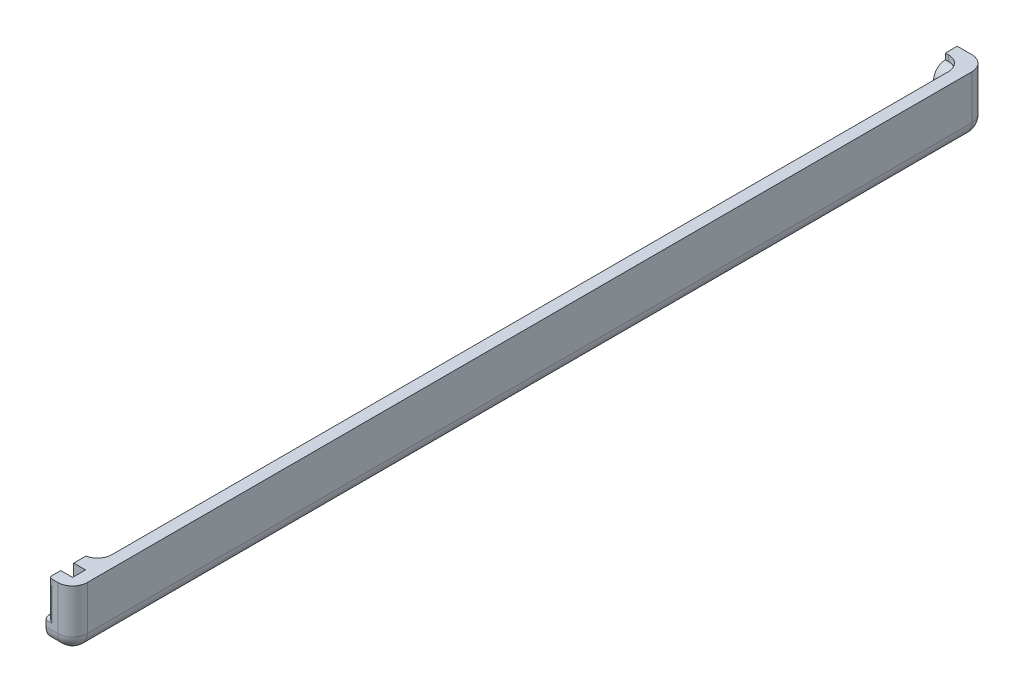
from build123d import *

# Parameters (mm, degrees)
SKETCH1_W                       = 39
SKETCH1_H                       = 155
BOSS_EXTRUDE1_DEPTH             = 2
BOSS_EXTRUDE2_DEPTH             = 38
SKETCH3_W                       = 2
SKETCH3_H                       = 2
BOSS_EXTRUDE3_DEPTH             = 38
SKETCH4_W                       = 2
SKETCH4_H                       = 2
BOSS_EXTRUDE4_DEPTH             = 151
SKETCH6_W                       = 35
SKETCH6_H                       = 2.2
CUT_EXTRUDE1_DEPTH              = 160.340045186
SKETCH7_W                       = 35
SKETCH7_H                       = 2.2
CUT_EXTRUDE2_DEPTH              = 89.490112442
SKETCH5_W                       = 31
SKETCH5_H                       = 2
BOSS_EXTRUDE5_DEPTH             = 2
BOSS_EXTRUDE6_REACH             = 91.367
SKETCH8_W                       = 2
SKETCH8_H                       = 2
BOSS_EXTRUDE6_DIRECTION_2_REACH = 91.367
SKETCH10_W                      = 2
SKETCH10_H                      = 2.2
SKETCH10_W_2                    = 2.2
SKETCH10_H_2                    = 2
BOSS_EXTRUDE8_DEPTH             = 2
SKETCH11_W                      = 2
SKETCH11_H                      = 2.2
SKETCH11_W_2                    = 2.2
SKETCH11_H_2                    = 2
BOSS_EXTRUDE9_DEPTH             = 2
FILLET2_R                       = 2.5
SKETCH14_W                      = 36.5
SKETCH14_H                      = 7.75
BOSS_EXTRUDE10_DEPTH            = 2
SKETCH13_W                      = 31
SKETCH13_H                      = 3
CUT_EXTRUDE4_DEPTH              = 2
FILLET3_R                       = 2
FILLET4_R                       = 0.5
SKETCH15_R                      = 5.1
CUT_EXTRUDE5_DEPTH              = 90.367219941
SKETCH16_R                      = 7.1
BOSS_EXTRUDE11_DEPTH            = 1
FILLET5_R                       = 0.5
CUT_EXTRUDE3_DEPTH              = 160.340045186
FILLET6_R                       = 0.4
FILLET7_R                       = 0.5
CUT_EXTRUDE6_DEPTH              = 6
SKETCH18_W                      = 29
SKETCH18_H                      = 3
CUT_EXTRUDE8_DEPTH              = 90.367220028
CUT_EXTRUDE11_DEPTH             = 90.367220028
CUT_EXTRUDE11_DEPTH_BACK        = 90.367220028
SKETCH20_W                      = 29
SKETCH20_H                      = 34
SKETCH21_W                      = 155
SKETCH21_H                      = 20
SKETCH21_H_2                    = 10
CUT_EXTRUDE12_DEPTH             = 90.367219941


with BuildPart() as part:
    # Sketch1 → Boss-Extrude1 (new body)
    with BuildSketch(Plane(origin=(0, 0, 0), x_dir=(1, 0, 0), z_dir=(0, 1, 0))):
        Rectangle(SKETCH1_W, SKETCH1_H)
    extrude(amount=BOSS_EXTRUDE1_DEPTH)

    # Sketch2 → Boss-Extrude2 (add)
    with BuildSketch(Plane(origin=(0, 2, 0), x_dir=(1, 0, 0), z_dir=(0, 1, 0))):
        Polygon((-17.5, -77.5), (-17.5, -75.5), (-17.5, 75.5), (17.5, 75.5), (17.5, -75.5), (17.5, -77.5), (19.5, -77.5), (19.5, 77.5), (-19.5, 77.5), (-19.5, -77.5), align=None)
    extrude(amount=BOSS_EXTRUDE2_DEPTH)

    # Sketch3 → Boss-Extrude3 (add)
    with BuildSketch(Plane(origin=(0, 2, 0), x_dir=(1, 0, 0), z_dir=(0, 1, 0))):
        with Locations((-16.5, -76.5)):
            Rectangle(SKETCH3_W, SKETCH3_H)
        with Locations((-16.5, -72.3)):
            Rectangle(SKETCH3_W, SKETCH3_H)
        with Locations((16.5, -76.5)):
            Rectangle(SKETCH3_W, SKETCH3_H)
        with Locations((16.5, -72.3)):
            Rectangle(SKETCH3_W, SKETCH3_H)
    extrude(amount=BOSS_EXTRUDE3_DEPTH)

    # Sketch4 → Boss-Extrude4 (add)
    with BuildSketch(Plane.XY.offset(-75.5)):
        with Locations((-16.5, 39)):
            Rectangle(SKETCH4_W, SKETCH4_H)
        Polygon((-15.5, 33.8), (-17.5, 31.8), (-17.5, 35.8), (-15.5, 35.8), align=None)
        Polygon((15.5, 35.8), (17.5, 35.8), (17.5, 31.8), (15.5, 33.8), align=None)
        with Locations((16.5, 39)):
            Rectangle(SKETCH4_W, SKETCH4_H)
    extrude(amount=BOSS_EXTRUDE4_DEPTH)

    # Sketch6 → Cut-Extrude1 (cut, through all)
    with BuildSketch(Plane.XY.offset(-75.5)):
        with Locations((0, 36.9)):
            Rectangle(SKETCH6_W, SKETCH6_H)
    extrude(amount=CUT_EXTRUDE1_DEPTH, mode=Mode.SUBTRACT)

    # Sketch7 → Cut-Extrude2 (cut, through all)
    with BuildSketch(Plane(origin=(0, 2, 0), x_dir=(1, 0, 0), z_dir=(0, 1, 0))):
        with Locations((0, -74.4)):
            Rectangle(SKETCH7_W, SKETCH7_H)
    extrude(amount=CUT_EXTRUDE2_DEPTH, mode=Mode.SUBTRACT)

    # Sketch5 → Boss-Extrude5 (add)
    with BuildSketch(Plane(origin=(0, 2, 0), x_dir=(1, 0, 0), z_dir=(0, 1, 0))):
        with Locations((0, -76.5)):
            Rectangle(SKETCH5_W, SKETCH5_H)
        with Locations((0, -72.3)):
            Rectangle(SKETCH5_W, SKETCH5_H)
    extrude(amount=BOSS_EXTRUDE5_DEPTH)

    # Boss-Extrude6: up to this face of the body (flat: up to its plane)
    boss_extrude6_end = Plane(part.part.faces().sort_by_distance((17.5, 16.9, -2.1))[0])
    # Sketch8 → Boss-Extrude6 (add, up to the picked face)
    with BuildSketch(Plane(origin=(0, 0, 0), x_dir=(0, 0, -1), z_dir=(1, 0, 0)), mode=Mode.PRIVATE) as boss_extrude6_sk1:
        with Locations((74.5, 39)):
            Rectangle(SKETCH8_W, SKETCH8_H)
    boss_extrude6_tool1 = split(extrude(boss_extrude6_sk1.sketch, amount=BOSS_EXTRUDE6_REACH, mode=Mode.PRIVATE), bisect_by=boss_extrude6_end, keep=Keep.BOTH, mode=Mode.PRIVATE)
    # Sketch8 → Boss-Extrude6 (add, up to the picked face)
    with BuildSketch(Plane(origin=(0, 0, 0), x_dir=(0, 0, -1), z_dir=(1, 0, 0)), mode=Mode.PRIVATE) as boss_extrude6_sk2:
        Polygon((75.5, 35.8), (73.5, 35.8), (73.5, 33.8), (75.5, 31.8), align=None)
    boss_extrude6_tool2 = split(extrude(boss_extrude6_sk2.sketch, amount=BOSS_EXTRUDE6_REACH, mode=Mode.PRIVATE), bisect_by=boss_extrude6_end, keep=Keep.BOTH, mode=Mode.PRIVATE)
    add(boss_extrude6_tool1.solids().sort_by(Axis((0, 39, -74.5), (1, 0, 0)))[0])
    add(boss_extrude6_tool2.solids().sort_by(Axis((0, 34.244444, -74.611111), (1, 0, 0)))[0])

    # Boss-Extrude6 direction 2: up to this face of the body (flat: up to its plane)
    boss_extrude6_direction_2_end = Plane(part.part.faces().sort_by_distance((-17.5, 16.9, -2.1))[0])
    # Sketch8 → Boss-Extrude6 direction 2 (add, up to the picked face)
    with BuildSketch(Plane(origin=(0, 0, 0), x_dir=(0, 0, -1), z_dir=(1, 0, 0)), mode=Mode.PRIVATE) as boss_extrude6_direction_2_sk1:
        with Locations((74.5, 39)):
            Rectangle(SKETCH8_W, SKETCH8_H)
    boss_extrude6_direction_2_tool1 = split(extrude(boss_extrude6_direction_2_sk1.sketch, amount=-BOSS_EXTRUDE6_DIRECTION_2_REACH, mode=Mode.PRIVATE), bisect_by=boss_extrude6_direction_2_end, keep=Keep.BOTH, mode=Mode.PRIVATE)
    # Sketch8 → Boss-Extrude6 direction 2 (add, up to the picked face)
    with BuildSketch(Plane(origin=(0, 0, 0), x_dir=(0, 0, -1), z_dir=(1, 0, 0)), mode=Mode.PRIVATE) as boss_extrude6_direction_2_sk2:
        Polygon((75.5, 35.8), (73.5, 35.8), (73.5, 33.8), (75.5, 31.8), align=None)
    boss_extrude6_direction_2_tool2 = split(extrude(boss_extrude6_direction_2_sk2.sketch, amount=-BOSS_EXTRUDE6_DIRECTION_2_REACH, mode=Mode.PRIVATE), bisect_by=boss_extrude6_direction_2_end, keep=Keep.BOTH, mode=Mode.PRIVATE)
    add(boss_extrude6_direction_2_tool1.solids().sort_by(Axis((0, 39, -74.5), (-1, 0, 0)))[0])
    add(boss_extrude6_direction_2_tool2.solids().sort_by(Axis((0, 34.244444, -74.611111), (-1, 0, 0)))[0])

    # Sketch10 → Boss-Extrude8 (add)
    with BuildSketch(Plane(origin=(-17.5, 0, 0), x_dir=(0, 0, -1), z_dir=(1, 0, 0))):
        with Locations((-76.5, 36.9)):
            Rectangle(SKETCH10_W, SKETCH10_H)
        with Locations((-74.4, 39)):
            Rectangle(SKETCH10_W_2, SKETCH10_H_2)
    extrude(amount=BOSS_EXTRUDE8_DEPTH)

    # Sketch11 → Boss-Extrude9 (add)
    with BuildSketch(Plane.ZY.offset(-17.5)):
        with Locations((76.5, 36.9)):
            Rectangle(SKETCH11_W, SKETCH11_H)
        with Locations((74.4, 39)):
            Rectangle(SKETCH11_W_2, SKETCH11_H_2)
    extrude(amount=BOSS_EXTRUDE9_DEPTH)

    # Fillet2
    fillet2_edges = [part.edges().sort_by_distance(p)[0] for p in [
        (-17.5, 16.9, 71.3),
        (17.5, 16.9, 71.3),
        (19.5, 20, 77.5),
        (-19.5, 20, 77.5),
        (-19.5, 20, -77.5),
        (-17.5, 16.9, -75.5),
        (17.5, 16.9, -75.5),
        (19.5, 20, -77.5),
        (19.5, 40, 0),
        (-19.5, 40, 0),
        (19.5, 0, 0),
        (-19.5, 0, 0),
        (0, 40, -77.5),
        (0, 0, 77.5),
        (0, 0, -77.5),
        (-17.5, 40, 77.5),
        (17.5, 40, 77.5),
    ]]
    fillet(fillet2_edges, radius=FILLET2_R)

    # Sketch14 → Boss-Extrude10 (add)
    with BuildSketch(Plane.XY.offset(-75.5)):
        with Locations((0, 5.125)):
            Rectangle(SKETCH14_W, SKETCH14_H)
    extrude(amount=BOSS_EXTRUDE10_DEPTH)

    # Sketch13 → Cut-Extrude4 (cut)
    with BuildSketch(Plane(origin=(0, 0, -77.5), x_dir=(-1, 0, 0), z_dir=(0, 0, -1))):
        with Locations((0, 5.5)):
            Rectangle(SKETCH13_W, SKETCH13_H)
    extrude(amount=-CUT_EXTRUDE4_DEPTH, mode=Mode.SUBTRACT)

    # Fillet3
    fillet3_edges = [part.edges().sort_by_distance(p)[0] for p in [
        (0, 9, -73.5),
    ]]
    fillet(fillet3_edges, radius=FILLET3_R - 0.0001)  # a hair under: the kernel refuses the full size

    # Fillet4
    fillet4_edges = [part.edges().sort_by_distance(p)[0] for p in [
        (15.5, 5.5, -75.5),
        (15.5, 4, -76.5),
        (0, 7, -75.5),
        (15.5, 7, -76.5),
        (-15.5, 5.5, -75.5),
        (-15.5, 7, -76.5),
        (0, 4, -75.5),
        (-15.5, 4, -76.5),
        (15.5, 5.5, -77.5),
        (0, 4, -77.5),
        (-15.5, 5.5, -77.5),
        (0, 7, -77.5),
    ]]
    fillet(fillet4_edges, radius=FILLET4_R)

    # Sketch15 → Cut-Extrude5 (cut, through all)
    with BuildSketch(Plane.XZ):
        with Locations(Location((0, 38.75, 0), (0, 0, 270))):
            Circle(SKETCH15_R)
        with Locations(Location((0, -38.75, 0), (0, 0, 270))):
            Circle(SKETCH15_R)
    extrude(amount=-CUT_EXTRUDE5_DEPTH, mode=Mode.SUBTRACT)

    # Sketch16 → Boss-Extrude11 (add)
    with BuildSketch(Plane(origin=(0, 2, 0), x_dir=(1, 0, 0), z_dir=(0, 1, 0))):
        with Locations(Location((0, 38.75, 0), (0, 0, 270))):
            Circle(SKETCH16_R)
        with Locations(Location((0, -38.75, 0), (0, 0, 270))):
            Circle(SKETCH16_R)
    extrude(amount=BOSS_EXTRUDE11_DEPTH)

    # Fillet5
    fillet5_edges = [part.edges().sort_by_distance(p)[0] for p in [
        (0, 2, -45.85),
        (0, 3, -45.85),
        (0, 2, 31.65),
        (0, 3, 31.65),
    ]]
    fillet(fillet5_edges, radius=FILLET5_R - 0.0001)  # a hair under: the kernel refuses the full size

    # Sketch12 → Cut-Extrude3 (cut, through all)
    with BuildSketch(Plane.XY.offset(-75.5)):
        with BuildLine():
            Line((1.668907005, 12.688040659), (2.22520934, 10.250720878))
            ThreePointArc((2.22520934, 10.250720878), (4.338837391, 10.990311321), (6.234898019, 12.181685175))
            Line((6.234898019, 12.181685175), (4.676173514, 14.136263881))
            ThreePointArc((4.676173514, 14.136263881), (3.254128043, 13.242733491), (1.668907005, 12.688040659))
        make_face()
        with BuildLine():
            ThreePointArc((-6.234898019, 12.181685175), (-4.338837391, 10.990311321), (-2.22520934, 10.250720878))
            Line((-2.22520934, 10.250720878), (-1.668907005, 12.688040659))
            ThreePointArc((-1.668907005, 12.688040659), (-3.254128043, 13.242733491), (-4.676173514, 14.136263881))
            Line((-4.676173514, 14.136263881), (-6.234898019, 12.181685175))
        make_face()
        with BuildLine():
            ThreePointArc((-10, 20), (-9.749279122, 17.77479066), (-9.009688679, 15.661162609))
            Line((-9.009688679, 15.661162609), (-6.757266509, 16.745871957))
            ThreePointArc((-6.757266509, 16.745871957), (-7.311959341, 18.331092995), (-7.5, 20))
            Line((-7.5, 20), (-10, 20))
        make_face()
        with BuildLine():
            ThreePointArc((-6.234898019, 27.818314825), (-7.818314825, 26.234898019), (-9.009688679, 24.338837391))
            Line((-9.009688679, 24.338837391), (-6.757266509, 23.254128043))
            ThreePointArc((-6.757266509, 23.254128043), (-5.863736119, 24.676173514), (-4.676173514, 25.863736119))
            Line((-4.676173514, 25.863736119), (-6.234898019, 27.818314825))
        make_face()
        with BuildLine():
            ThreePointArc((-1.668907005, 27.311959341), (-0.839733571, 27.452841574), (0, 27.5))
            Line((0, 27.5), (0, 30))
            ThreePointArc((0, 30), (-1.119644761, 29.937122099), (-2.22520934, 29.749279122))
            Line((-2.22520934, 29.749279122), (-1.668907005, 27.311959341))
        make_face()
        with BuildLine():
            Line((0, 30), (0, 27.5))
            ThreePointArc((0, 27.5), (0.839733571, 27.452841574), (1.668907005, 27.311959341))
            Line((1.668907005, 27.311959341), (2.22520934, 29.749279122))
            ThreePointArc((2.22520934, 29.749279122), (1.119644761, 29.937122099), (0, 30))
        make_face()
        with BuildLine():
            Line((6.757266509, 23.254128043), (9.009688679, 24.338837391))
            ThreePointArc((9.009688679, 24.338837391), (7.818314825, 26.234898019), (6.234898019, 27.818314825))
            Line((6.234898019, 27.818314825), (4.676173514, 25.863736119))
            ThreePointArc((4.676173514, 25.863736119), (5.863736119, 24.676173514), (6.757266509, 23.254128043))
        make_face()
        with BuildLine():
            Line((6.757266509, 16.745871957), (9.009688679, 15.661162609))
            ThreePointArc((9.009688679, 15.661162609), (9.749279122, 17.77479066), (10, 20))
            Line((10, 20), (7.5, 20))
            ThreePointArc((7.5, 20), (7.311959341, 18.331092995), (6.757266509, 16.745871957))
        make_face()
        with BuildLine():
            ThreePointArc((2.5, 20), (2.43731978, 19.443697665), (2.25242217, 18.915290652))
            Line((2.25242217, 18.915290652), (4.50484434, 17.830581304))
            ThreePointArc((4.50484434, 17.830581304), (4.874639561, 18.88739533), (5, 20))
            Line((5, 20), (2.5, 20))
        make_face()
        with BuildLine():
            ThreePointArc((1.558724505, 21.954578706), (1.954578706, 21.558724505), (2.25242217, 21.084709348))
            Line((2.25242217, 21.084709348), (4.50484434, 22.169418696))
            ThreePointArc((4.50484434, 22.169418696), (3.909157412, 23.117449009), (3.117449009, 23.909157412))
            Line((3.117449009, 23.909157412), (1.558724505, 21.954578706))
        make_face()
        with BuildLine():
            Line((0, 25), (0, 22.5))
            ThreePointArc((0, 22.5), (0.27991119, 22.484280525), (0.556302335, 22.43731978))
            Line((0.556302335, 22.43731978), (1.11260467, 24.874639561))
            ThreePointArc((1.11260467, 24.874639561), (0.559822381, 24.968561049), (0, 25))
        make_face()
        with BuildLine():
            ThreePointArc((-0.556302335, 22.43731978), (-0.27991119, 22.484280525), (0, 22.5))
            Line((0, 22.5), (0, 25))
            ThreePointArc((0, 25), (-0.559822381, 24.968561049), (-1.11260467, 24.874639561))
            Line((-1.11260467, 24.874639561), (-0.556302335, 22.43731978))
        make_face()
        with BuildLine():
            ThreePointArc((-2.25242217, 21.084709348), (-1.954578706, 21.558724505), (-1.558724505, 21.954578706))
            Line((-1.558724505, 21.954578706), (-3.117449009, 23.909157412))
            ThreePointArc((-3.117449009, 23.909157412), (-3.909157412, 23.117449009), (-4.50484434, 22.169418696))
            Line((-4.50484434, 22.169418696), (-2.25242217, 21.084709348))
        make_face()
        with BuildLine():
            ThreePointArc((-2.25242217, 18.915290652), (-2.43731978, 19.443697665), (-2.5, 20))
            Line((-2.5, 20), (-5, 20))
            ThreePointArc((-5, 20), (-4.874639561, 18.88739533), (-4.50484434, 17.830581304))
            Line((-4.50484434, 17.830581304), (-2.25242217, 18.915290652))
        make_face()
        with BuildLine():
            ThreePointArc((-3.117449009, 16.090842588), (-2.169418696, 15.49515566), (-1.11260467, 15.125360439))
            Line((-1.11260467, 15.125360439), (-0.556302335, 17.56268022))
            ThreePointArc((-0.556302335, 17.56268022), (-1.084709348, 17.74757783), (-1.558724505, 18.045421294))
            Line((-1.558724505, 18.045421294), (-3.117449009, 16.090842588))
        make_face()
        with BuildLine():
            Line((0.556302335, 17.56268022), (1.11260467, 15.125360439))
            ThreePointArc((1.11260467, 15.125360439), (2.169418696, 15.49515566), (3.117449009, 16.090842588))
            Line((3.117449009, 16.090842588), (1.558724505, 18.045421294))
            ThreePointArc((1.558724505, 18.045421294), (1.084709348, 17.74757783), (0.556302335, 17.56268022))
        make_face()
    extrude(amount=-CUT_EXTRUDE3_DEPTH, mode=Mode.SUBTRACT)

    # Fillet6
    fillet6_edges = [part.edges().sort_by_distance(p)[0] for p in [
        (5.863736119, 24.676173514, -75.5),
        (5.455535766, 26.841025472, -75.5),
        (7.818314825, 26.234898019, -77.5),
        (7.883477594, 23.796482717, -77.5),
        (5.863736119, 24.676173514, -77.5),
        (5.455535766, 26.841025472, -77.5),
        (7.883477594, 23.796482717, -75.5),
        (7.818314825, 26.234898019, -75.5),
        (7.311959341, 18.331092995, -75.5),
        (8.75, 20, -75.5),
        (9.749279122, 17.77479066, -77.5),
        (7.883477594, 16.203517283, -77.5),
        (7.311959341, 18.331092995, -77.5),
        (8.75, 20, -77.5),
        (7.883477594, 16.203517283, -75.5),
        (9.749279122, 17.77479066, -75.5),
        (2.43731978, 19.443697665, -75.5),
        (3.75, 20, -75.5),
        (4.874639561, 18.88739533, -77.5),
        (3.378633255, 18.372935978, -77.5),
        (2.43731978, 19.443697665, -77.5),
        (3.75, 20, -77.5),
        (3.378633255, 18.372935978, -75.5),
        (4.874639561, 18.88739533, -75.5),
        (1.954578706, 21.558724505, -75.5),
        (2.338086757, 22.931868059, -75.5),
        (3.909157412, 23.117449009, -77.5),
        (3.378633255, 21.627064022, -77.5),
        (1.954578706, 21.558724505, -77.5),
        (2.338086757, 22.931868059, -77.5),
        (3.378633255, 21.627064022, -75.5),
        (3.909157412, 23.117449009, -75.5),
        (0, 27.5, -75.5),
        (-1.947058172, 28.530619232, -75.5),
        (0, 30, -77.5),
        (1.947058172, 28.530619232, -77.5),
        (0, 27.5, -77.5),
        (-1.947058172, 28.530619232, -77.5),
        (1.947058172, 28.530619232, -75.5),
        (0, 30, -75.5),
        (-5.863736119, 24.676173514, -75.5),
        (-7.883477594, 23.796482717, -75.5),
        (-7.818314825, 26.234898019, -77.5),
        (-5.455535766, 26.841025472, -77.5),
        (-5.863736119, 24.676173514, -77.5),
        (-7.883477594, 23.796482717, -77.5),
        (-5.455535766, 26.841025472, -75.5),
        (-7.818314825, 26.234898019, -75.5),
        (-7.311959341, 18.331092995, -75.5),
        (-7.883477594, 16.203517283, -75.5),
        (-9.749279122, 17.77479066, -77.5),
        (-8.75, 20, -77.5),
        (-7.311959341, 18.331092995, -77.5),
        (-7.883477594, 16.203517283, -77.5),
        (-8.75, 20, -75.5),
        (-9.749279122, 17.77479066, -75.5),
        (-3.254128043, 13.242733491, -75.5),
        (-1.947058172, 11.469380768, -75.5),
        (-4.338837391, 10.990311321, -77.5),
        (-5.455535766, 13.158974528, -77.5),
        (-3.254128043, 13.242733491, -77.5),
        (-1.947058172, 11.469380768, -77.5),
        (-5.455535766, 13.158974528, -75.5),
        (-4.338837391, 10.990311321, -75.5),
        (1.084709348, 17.74757783, -75.5),
        (2.338086757, 17.068131941, -75.5),
        (2.169418696, 15.49515566, -77.5),
        (0.834453502, 16.344020329, -77.5),
        (1.084709348, 17.74757783, -77.5),
        (2.338086757, 17.068131941, -77.5),
        (0.834453502, 16.344020329, -75.5),
        (2.169418696, 15.49515566, -75.5),
        (-2.43731978, 19.443697665, -75.5),
        (-3.378633255, 18.372935978, -75.5),
        (-4.874639561, 18.88739533, -77.5),
        (-3.75, 20, -77.5),
        (-2.43731978, 19.443697665, -77.5),
        (-3.378633255, 18.372935978, -77.5),
        (-3.75, 20, -75.5),
        (-4.874639561, 18.88739533, -75.5),
        (-1.084709348, 17.74757783, -75.5),
        (-0.834453502, 16.344020329, -75.5),
        (-2.169418696, 15.49515566, -77.5),
        (-2.338086757, 17.068131941, -77.5),
        (-1.084709348, 17.74757783, -77.5),
        (-0.834453502, 16.344020329, -77.5),
        (-2.338086757, 17.068131941, -75.5),
        (-2.169418696, 15.49515566, -75.5),
        (-1.954578706, 21.558724505, -75.5),
        (-3.378633255, 21.627064022, -75.5),
        (-3.909157412, 23.117449009, -77.5),
        (-2.338086757, 22.931868059, -77.5),
        (-1.954578706, 21.558724505, -77.5),
        (-3.378633255, 21.627064022, -77.5),
        (-2.338086757, 22.931868059, -75.5),
        (-3.909157412, 23.117449009, -75.5),
        (0, 25, -77.5),
        (0.834453502, 23.655979671, -77.5),
        (0, 22.5, -75.5),
        (-0.834453502, 23.655979671, -75.5),
        (0, 22.5, -77.5),
        (-0.834453502, 23.655979671, -77.5),
        (0, 25, -75.5),
        (0.834453502, 23.655979671, -75.5),
        (3.254128043, 13.242733491, -75.5),
        (5.455535766, 13.158974528, -75.5),
        (4.338837391, 10.990311321, -77.5),
        (1.947058172, 11.469380768, -77.5),
        (3.254128043, 13.242733491, -77.5),
        (5.455535766, 13.158974528, -77.5),
        (1.947058172, 11.469380768, -75.5),
        (4.338837391, 10.990311321, -75.5),
    ]]
    fillet(fillet6_edges, radius=FILLET6_R)

    # Fillet7
    fillet7_edges = [part.edges().sort_by_distance(p)[0] for p in [
        (15.5, 40, 0.75),
        (0, 4, 77.5),
        (0, 40, -73.5),
        (-15.5, 40, 0.75),
        (-15.5, 20.75, 77.5),
        (-15.5, 39.267766953, 76.767766953),
        (15.5, 20.75, 77.5),
        (15.5, 39.267766953, 76.767766953),
    ]]
    fillet(fillet7_edges, radius=FILLET7_R)

    # Sketch17 → Cut-Extrude6 (cut)
    with BuildSketch(Plane.XZ):
        Polygon((-17, -77.5), (-17, 70.299999999), (-14.999999999, 71.3), (-14.999999999, 77.5), (14.999999999, 77.5), (14.999999999, 71.3), (17, 70.299999999), (17, -77.5), align=None)
    extrude(amount=-CUT_EXTRUDE6_DEPTH, mode=Mode.SUBTRACT)

    # Sketch18 → Cut-Extrude8 (cut, through all)
    with BuildSketch(Plane.XY):
        with Locations((0, 7.5)):
            Rectangle(SKETCH18_W, SKETCH18_H)
    extrude(amount=-CUT_EXTRUDE8_DEPTH, mode=Mode.SUBTRACT)

    # Sketch20 → Cut-Extrude11 (cut, two sides: drawn at the far end of the back side and taken through both)
    with BuildSketch(Plane.XY.offset(-CUT_EXTRUDE11_DEPTH_BACK)):
        with Locations((0, 23)):
            Rectangle(SKETCH20_W, SKETCH20_H)
    extrude(amount=CUT_EXTRUDE11_DEPTH + CUT_EXTRUDE11_DEPTH_BACK, mode=Mode.SUBTRACT)


with BuildPart() as body_2:
    # of the pieces the cut leaves, the one that is kept (cut_extrude11_keep)
    add(part.part.solids().sort_by_distance((14.5, 40, -75))[0])

    # Sketch21 → Cut-Extrude12 (cut, through all)
    with BuildSketch(Plane(origin=(0, 0, 0), x_dir=(0, 0, -1), z_dir=(1, 0, 0))):
        with Locations((0, 20)):
            Rectangle(SKETCH21_W, SKETCH21_H)
        with Locations((0, 35)):
            Rectangle(SKETCH21_W, SKETCH21_H_2)
    extrude(amount=CUT_EXTRUDE12_DEPTH, mode=Mode.SUBTRACT)


solid = body_2.part
